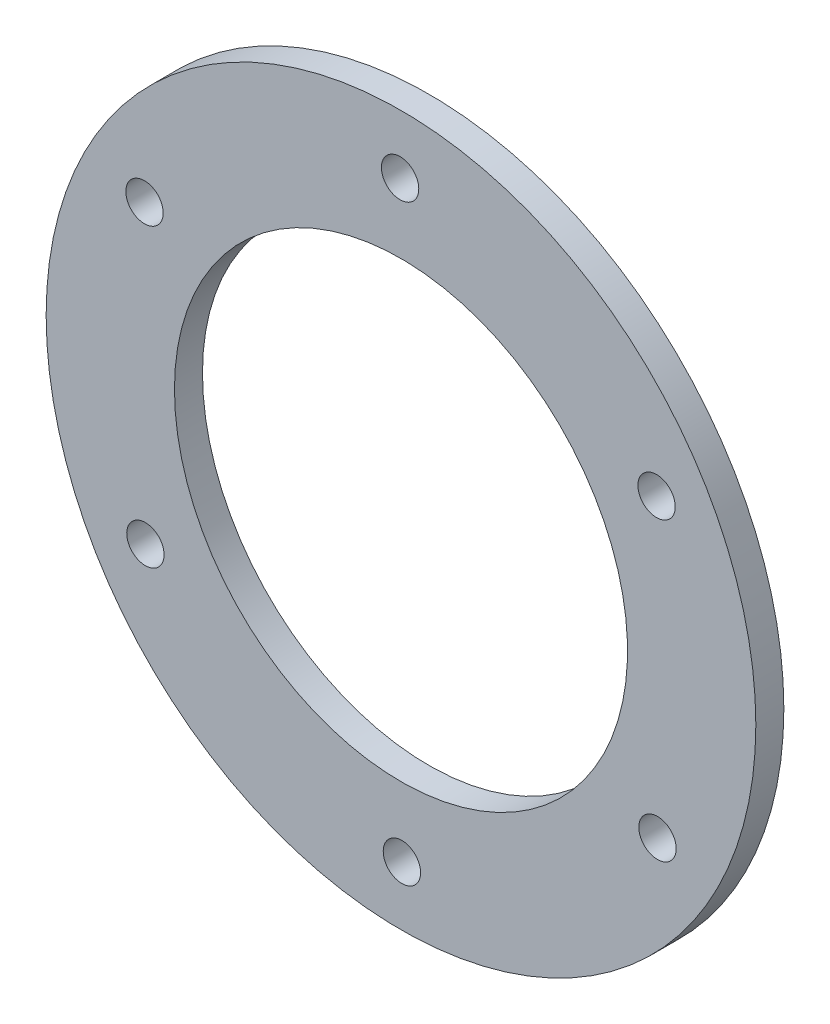
from build123d import *

# Parameters (mm, degrees)
SKETCH1_R         = 120.65
SKETCH1_R_2       = 77.0255
EXTRUDE1_DEPTH    = 9.525
CIRPATTERN1_COUNT = 6


with BuildPart() as part:
    # Sketch1 → Extrude1 (new body)
    with BuildSketch(Plane.XY):
        with Locations((-1180.801967646, 3304.624367058)):
            Circle(SKETCH1_R)
        with Locations((-1180.801967646, 3304.624367058)):
            Circle(SKETCH1_R_2, mode=Mode.SUBTRACT)
    extrude(amount=EXTRUDE1_DEPTH)

    # Sketch2 → 1/2 (0.5) Diameter Hole1 (revolve, cut)
    with BuildSketch(Plane(origin=(-1181.110017292, 3405.144251061, 9.525), x_dir=(0, -1, 0), z_dir=(1, 0, 0))):
        Polygon((0, 0), (0, 29.215464931), (6.35, 25.4), (6.35, 0), align=None)
    f_1_2_0_5_diameter_hole1 = revolve(axis=Axis((-1181.110017292, 3405.144251061, 15.875), (0, 0, -1)), mode=Mode.SUBTRACT)

    # CirPattern1: 1/2 (0.5) Diameter Hole1 ×6 about axis
    cirpattern1_axis = Axis((-1180.801967646, 3304.624367058, 0), (0, 0, -1))
    for i in range(1, CIRPATTERN1_COUNT):
        add(f_1_2_0_5_diameter_hole1.rotate(cirpattern1_axis, i * 360 / CIRPATTERN1_COUNT), mode=Mode.SUBTRACT)


solid = part.part
